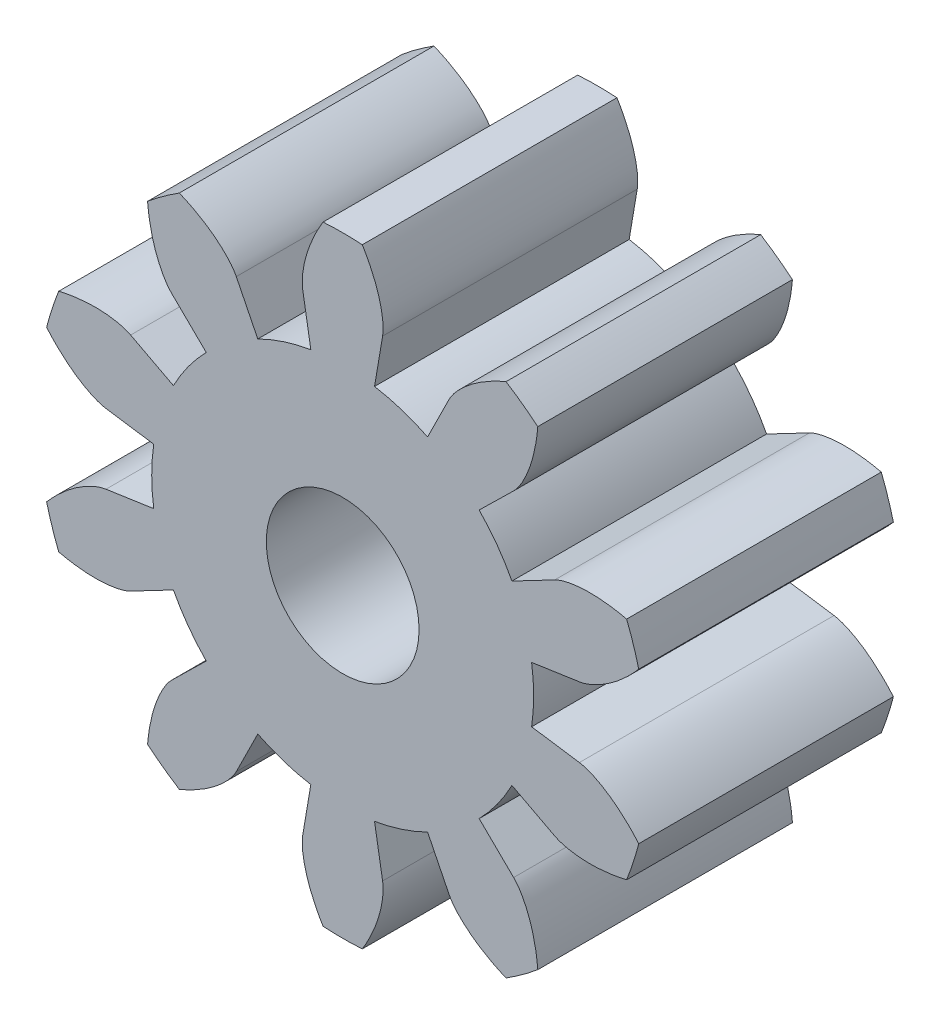
from build123d import *

# Parameters (mm, degrees)
SKETCH_1_R               = 6
SKETCH_1_R_2             = 1.5
EXTRUDE_1_DEPTH          = 5
CUT_EXTRUDE_1_DEPTH      = 10.848857802
PATTERN_CIRCULAR_1_COUNT = 10
PATTERN_CIRCULAR_1_ANGLE = 324


with BuildPart() as part:
    # 草图1 → 凸台-拉伸1 (new body)
    with BuildSketch(Plane.XY):
        Circle(SKETCH_1_R)
        Circle(SKETCH_1_R_2, mode=Mode.SUBTRACT)
    extrude(amount=EXTRUDE_1_DEPTH)

    # 草图1<3> → 切除-拉伸1 (cut, through all)
    with BuildSketch(Plane.XY):
        with BuildLine():
            Line((4.648088484, 0.686169791), (3.709794337, 0.54765498))
            ThreePointArc((3.709794337, 0.54765498), (3.739935077, 0.274564415), (3.75, 0))
            ThreePointArc((3.75, 0), (3.739935077, -0.274564415), (3.709794337, -0.54765498))
            Line((3.709794337, -0.54765498), (4.648088484, -0.686169791))
            add(Edge.make_bspline(
                [(4.648088484, -0.686169791), (4.683519606, -0.691400277), (4.781309106, -0.713360714), (4.960006956, -0.784137383), (5.231114785, -0.93748748), (5.485686634, -1.139450354), (5.670129672, -1.321731466), (5.782028037, -1.447201978), (5.813609798, -1.483893904)],
                knots=[0, 0, 0, 0, 0, 0.005604068, 0.015718248, 0.029959916, 0.048733667, 0.056327564, 0.056327564, 0.056327564, 0.056327564, 0.056327564], degree=4))
            ThreePointArc((5.813609798, -1.483893904), (5.953220086, -0.74777711), (6, 0))
            ThreePointArc((6, 0), (5.953220086, 0.74777711), (5.813609798, 1.483893904))
            add(Edge.make_bspline(
                [(4.648088484, 0.686169791), (4.683519606, 0.691400277), (4.781309106, 0.713360714), (4.960006956, 0.784137383), (5.231114785, 0.93748748), (5.485686634, 1.139450354), (5.670129672, 1.321731466), (5.782028037, 1.447201978), (5.813609798, 1.483893904)],
                knots=[0, 0, 0, 0, 0, 0.005604068, 0.015718248, 0.029959916, 0.048733667, 0.056327564, 0.056327564, 0.056327564, 0.056327564, 0.056327564], degree=4))
        make_face()
    cut_extrude_1 = extrude(amount=CUT_EXTRUDE_1_DEPTH, mode=Mode.SUBTRACT)

    # 阵列(圆周)1: 切除-拉伸1 ×10 about axis
    pattern_circular_1_axis = Axis((0, 0, 5), (0, 0, 1))
    for i in range(1, PATTERN_CIRCULAR_1_COUNT):
        add(cut_extrude_1.rotate(pattern_circular_1_axis, i * PATTERN_CIRCULAR_1_ANGLE / (PATTERN_CIRCULAR_1_COUNT - 1)), mode=Mode.SUBTRACT)


solid = part.part
